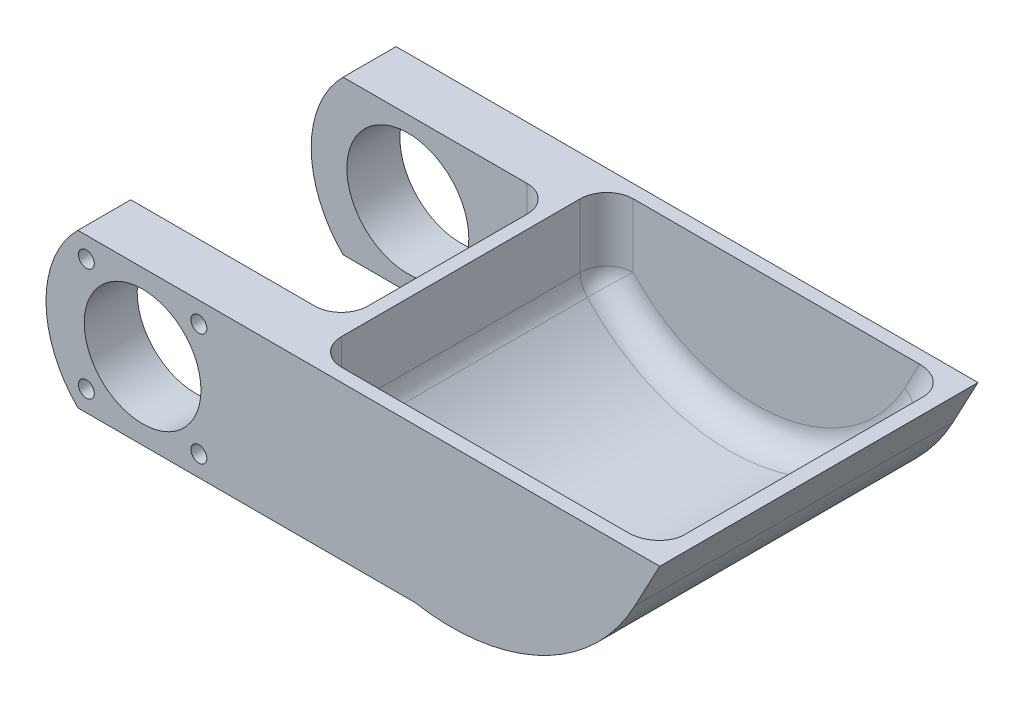
from build123d import *

# Parameters (mm, degrees)
SKETCH1_W                       = 88.9
SKETCH1_H                       = 76.2
BOSS_EXTRUDE1_DEPTH             = 37.592
CUT_EXTRUDE1_REACH              = 124.975
SHELL1_T                        = -3.175
SKETCH16_W                      = 12.664560545
SKETCH16_H                      = 36.83
SKETCH16_W_2                    = 12.692903968
BOSS_EXTRUDE4_DEPTH             = 63.5
BOSS_EXTRUDE4_DIRECTION_2_REACH = 124.975
CUT_EXTRUDE2_REACH              = 171.328
SKETCH18_R                      = 14.605
CUT_EXTRUDE3_REACH              = 171.339
SKETCH20_R                      = 13.97
SKETCH20_R_2                    = 1.905
CUT_EXTRUDE4_DEPTH              = 175.485983575
FILLET2_R                       = 6.35


with BuildPart() as part:
    # Sketch1 → Boss-Extrude1 (new body)
    with BuildSketch(Plane(origin=(0, 0, 0), x_dir=(1, 0, 0), z_dir=(0, 1, 0))):
        with Locations((-44.45, 38.1)):
            Rectangle(SKETCH1_W, SKETCH1_H)
    extrude(amount=-BOSS_EXTRUDE1_DEPTH)

    # Sketch2 → Cut-Extrude1 (cut, up to next)
    with BuildSketch(Plane.XY, mode=Mode.PRIVATE) as cut_extrude1_sk1:
        with BuildLine():
            ThreePointArc((-49.926198023, -37.592), (-71.560931997, -32.647565517), (-88.9, -18.796))
            Line((-88.9, -18.796), (-88.9, -37.592))
            Line((-88.9, -37.592), (-49.926198023, -37.592))
        make_face()
    cut_extrude1_tool1 = extrude(cut_extrude1_sk1.sketch, amount=-CUT_EXTRUDE1_REACH, mode=Mode.PRIVATE) & part.part
    # Sketch2 → Cut-Extrude1 (cut, up to next)
    with BuildSketch(Plane.XY, mode=Mode.PRIVATE) as cut_extrude1_sk2:
        with BuildLine():
            Line((0, -37.592), (0, 0))
            Line((0, 0), (-5.972186469, -11.208166165))
            ThreePointArc((-5.972186469, -11.208166165), (-24.293885313, -30.489622768), (-49.926198023, -37.592))
            Line((-49.926198023, -37.592), (0, -37.592))
        make_face()
    cut_extrude1_tool2 = extrude(cut_extrude1_sk2.sketch, amount=-CUT_EXTRUDE1_REACH, mode=Mode.PRIVATE) & part.part
    add(cut_extrude1_tool1.solids().sort_by_distance((-79.562366, -32.198077, 0))[0], mode=Mode.SUBTRACT)
    add(cut_extrude1_tool2.solids().sort_by_distance((-11.384711, -27.029682, 0))[0], mode=Mode.SUBTRACT)

    # Shell1
    shell1_openings = [part.faces().sort_by_distance(p)[0] for p in [
        (-44.45, 0, -38.1),
    ]]
    offset(amount=SHELL1_T, openings=shell1_openings, kind=Kind.INTERSECTION)

    # Sketch16 → Boss-Extrude4 (add)
    with BuildSketch(Plane.ZY.offset(88.9)):
        with Locations((-6.332280273, -18.415)):
            Rectangle(SKETCH16_W, SKETCH16_H)
        with Locations((-69.853548016, -18.415)):
            Rectangle(SKETCH16_W_2, SKETCH16_H)
    extrude(amount=BOSS_EXTRUDE4_DEPTH)

    # Sketch16 → Boss-Extrude4 direction 2 (add, up to next)
    with BuildSketch(Plane.ZY.offset(88.9), mode=Mode.PRIVATE) as boss_extrude4_direction_2_sk1:
        with Locations((-6.332280273, -18.415)):
            Rectangle(SKETCH16_W, SKETCH16_H)
    boss_extrude4_direction_2_tool1 = extrude(boss_extrude4_direction_2_sk1.sketch, amount=-BOSS_EXTRUDE4_DIRECTION_2_REACH, mode=Mode.PRIVATE) - part.part
    # Sketch16 → Boss-Extrude4 direction 2 (add, up to next)
    with BuildSketch(Plane.ZY.offset(88.9), mode=Mode.PRIVATE) as boss_extrude4_direction_2_sk2:
        with Locations((-69.853548016, -18.415)):
            Rectangle(SKETCH16_W_2, SKETCH16_H)
    boss_extrude4_direction_2_tool2 = extrude(boss_extrude4_direction_2_sk2.sketch, amount=-BOSS_EXTRUDE4_DIRECTION_2_REACH, mode=Mode.PRIVATE) - part.part
    add(boss_extrude4_direction_2_tool1.solids().sort_by_distance((-88.9, -18.415, -6.33228))[0])
    add(boss_extrude4_direction_2_tool2.solids().sort_by_distance((-88.9, -18.415, -69.853548))[0])

    # Sketch18 → Cut-Extrude2 (cut, up to next)
    with BuildSketch(Plane.XY.offset(-63.507096032), mode=Mode.PRIVATE) as cut_extrude2_sk1:
        with Locations((-123.825, -18.415)):
            Circle(SKETCH18_R)
    cut_extrude2_tool1 = extrude(cut_extrude2_sk1.sketch, amount=-CUT_EXTRUDE2_REACH, mode=Mode.PRIVATE) & part.part
    add(cut_extrude2_tool1.solids().sort_by_distance((-123.825, -18.415, -63.507096))[0], mode=Mode.SUBTRACT)

    # Sketch20 → Cut-Extrude3 (cut, up to next)
    with BuildSketch(Plane(origin=(0, 0, -12.664560545), x_dir=(-1, 0, 0), z_dir=(0, 0, -1)), mode=Mode.PRIVATE) as cut_extrude3_sk1:
        with Locations((123.825, -18.415)):
            Circle(SKETCH20_R)
    cut_extrude3_tool1 = extrude(cut_extrude3_sk1.sketch, amount=-CUT_EXTRUDE3_REACH, mode=Mode.PRIVATE) & part.part
    # Sketch20 → Cut-Extrude3 (cut, up to next)
    with BuildSketch(Plane(origin=(0, 0, -12.664560545), x_dir=(-1, 0, 0), z_dir=(0, 0, -1)), mode=Mode.PRIVATE) as cut_extrude3_sk2:
        with Locations((137.295382, -4.944618)):
            Circle(SKETCH20_R_2)
    cut_extrude3_tool2 = extrude(cut_extrude3_sk2.sketch, amount=-CUT_EXTRUDE3_REACH, mode=Mode.PRIVATE) & part.part
    # Sketch20 → Cut-Extrude3 (cut, up to next)
    with BuildSketch(Plane(origin=(0, 0, -12.664560545), x_dir=(-1, 0, 0), z_dir=(0, 0, -1)), mode=Mode.PRIVATE) as cut_extrude3_sk3:
        with Locations((137.295382, -31.885382)):
            Circle(SKETCH20_R_2)
    cut_extrude3_tool3 = extrude(cut_extrude3_sk3.sketch, amount=-CUT_EXTRUDE3_REACH, mode=Mode.PRIVATE) & part.part
    # Sketch20 → Cut-Extrude3 (cut, up to next)
    with BuildSketch(Plane(origin=(0, 0, -12.664560545), x_dir=(-1, 0, 0), z_dir=(0, 0, -1)), mode=Mode.PRIVATE) as cut_extrude3_sk4:
        with Locations((110.354618, -31.885382)):
            Circle(SKETCH20_R_2)
    cut_extrude3_tool4 = extrude(cut_extrude3_sk4.sketch, amount=-CUT_EXTRUDE3_REACH, mode=Mode.PRIVATE) & part.part
    # Sketch20 → Cut-Extrude3 (cut, up to next)
    with BuildSketch(Plane(origin=(0, 0, -12.664560545), x_dir=(-1, 0, 0), z_dir=(0, 0, -1)), mode=Mode.PRIVATE) as cut_extrude3_sk5:
        with Locations((110.354618, -4.944618)):
            Circle(SKETCH20_R_2)
    cut_extrude3_tool5 = extrude(cut_extrude3_sk5.sketch, amount=-CUT_EXTRUDE3_REACH, mode=Mode.PRIVATE) & part.part
    add(cut_extrude3_tool1.solids().sort_by_distance((-123.825, -18.415, -12.664561))[0], mode=Mode.SUBTRACT)
    add(cut_extrude3_tool2.solids().sort_by_distance((-137.295382, -4.944618, -12.664561))[0], mode=Mode.SUBTRACT)
    add(cut_extrude3_tool3.solids().sort_by_distance((-137.295382, -31.885382, -12.664561))[0], mode=Mode.SUBTRACT)
    add(cut_extrude3_tool4.solids().sort_by_distance((-110.354618, -31.885382, -12.664561))[0], mode=Mode.SUBTRACT)
    add(cut_extrude3_tool5.solids().sort_by_distance((-110.354618, -4.944618, -12.664561))[0], mode=Mode.SUBTRACT)

    # Sketch22 → Cut-Extrude4 (cut, through all)
    with BuildSketch(Plane(origin=(0, 0, -76.2), x_dir=(-1, 0, 0), z_dir=(0, 0, -1))):
        with BuildLine():
            Line((139.329278278, 0), (152.4, 0))
            Line((152.4, 0), (152.4, -36.83))
            Line((152.4, -36.83), (139.329278278, -36.83))
            ThreePointArc((139.329278278, -36.83), (146.957021029, -18.415), (139.329278278, 0))
        make_face()
    extrude(amount=-CUT_EXTRUDE4_DEPTH, mode=Mode.SUBTRACT)

    # Fillet2
    fillet2_edges = [part.edges().sort_by_distance(p)[0] for p in [
        (-75.401646537, -30.583390997, -63.507096032),
        (-75.401646537, -30.583390997, -12.664560545),
        (-88.9, -9.398, -63.507096032),
        (-88.9, -9.398, -12.664560545),
        (-6.185914068, -4.857559774, -73.025),
        (-6.185914068, -4.857559774, -3.175),
        (-85.725, -8.83323263, -73.025),
        (-45.133487238, -34.170041352, -73.025),
        (-85.725, -17.66646526, -38.1),
        (-85.725, -8.83323263, -3.175),
        (-45.133487238, -34.170041352, -3.175),
    ]]
    fillet(fillet2_edges, radius=FILLET2_R - 0.0001)  # a hair under: the kernel refuses the full size


solid = part.part
